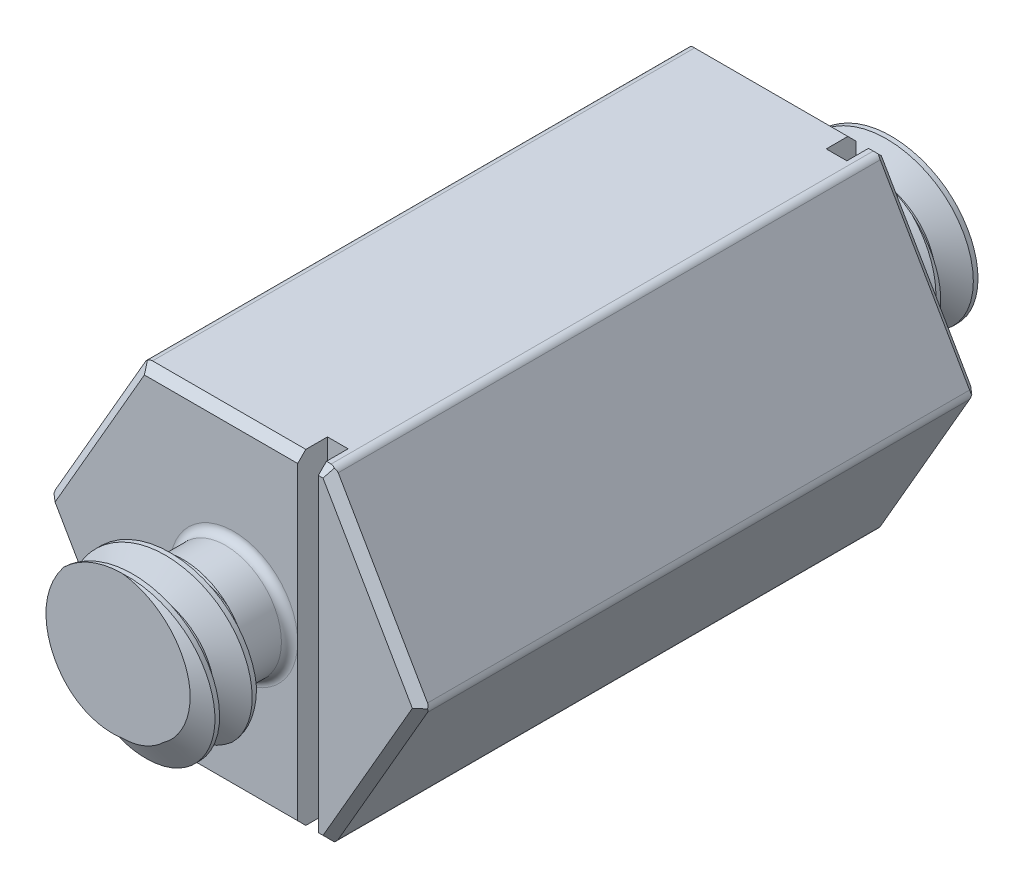
from build123d import *

# Parameters (mm, degrees)
BOSS_EXTRUDE1_DEPTH      = 4.7625
BOSS_EXTRUDE1_DEPTH_BACK = 4.7625
CHAMFER1_SIZE            = 0.13890625
FILLET1_R                = 0.13890625
CUT_SWEEP1_PITCH         = 0.635
CIRPATTERN1_COUNT        = 2
SKETCH7_R                = 2.276685385
CUT_EXTRUDE1_DEPTH       = 4.445
CUT_EXTRUDE2_START       = -22.225
SKETCH7_2_R              = 2.276685385
CUT_EXTRUDE2_DEPTH       = 4.445
SKETCH8_W                = 0.352149845
SKETCH8_H                = 2.63921875
SKETCH8_H_2              = 0.13890625
CUT_EXTRUDE3_DEPTH       = 0.508
CUT_EXTRUDE4_START       = -9.525
SKETCH8_3_W              = 0.352149845
SKETCH8_3_H              = 0.13890625
SKETCH8_3_H_2            = 2.63921875
CUT_EXTRUDE4_DEPTH       = 0.508


with BuildPart() as part:
    # Sketch3 → Revolve1 (revolve)
    with BuildSketch(Plane(origin=(0, 0, 0), x_dir=(0, 0, -1), z_dir=(1, 0, 0)), mode=Mode.PRIVATE) as revolve1_sk:
        Polygon((11.1125, 0), (-11.1125, 0), (-11.1125, 1.21285), (-10.90295, 1.4224), (-5.795796891, 1.4224), (-5.5245, 0.9525), (-4.7625, 0.9525), (-4.7625, 2.778125), (4.7625, 2.778125), (4.7625, 0.9525), (5.5245, 0.9525), (5.795796891, 1.4224), (10.90295, 1.4224), (11.1125, 1.21285), align=None)
    revolve(revolve1_sk.sketch.rotate(Axis((0, 0, 11.1125), (0, 0, -1)), 90), axis=Axis((0, 0, 11.1125), (0, 0, -1)))

    # Sketch4 → Boss-Extrude1 (add, two sides: drawn at the far end of the back side and taken through both)
    with BuildSketch(Plane.XY.offset(-BOSS_EXTRUDE1_DEPTH_BACK)):
        Polygon((-3.207902433, 0), (-1.603951217, -2.778125), (1.603951217, -2.778125), (3.207902433, 0), (1.603951217, 2.778125), (-1.603951217, 2.778125), align=None)
    extrude(amount=BOSS_EXTRUDE1_DEPTH + BOSS_EXTRUDE1_DEPTH_BACK)

    # Chamfer1
    chamfer1_edges = [part.edges().sort_by_distance(p)[0] for p in [
        (2.405926825, 1.3890625, 4.7625),
        (0, 2.778125, 4.7625),
        (-2.405926825, 1.3890625, 4.7625),
        (-2.405926825, -1.3890625, 4.7625),
        (0, -2.778125, 4.7625),
        (2.405926825, -1.3890625, 4.7625),
        (-2.405926825, 1.3890625, -4.7625),
        (0, 2.778125, -4.7625),
        (2.405926825, 1.3890625, -4.7625),
        (2.405926825, -1.3890625, -4.7625),
        (0, -2.778125, -4.7625),
        (-2.405926825, -1.3890625, -4.7625),
    ]]
    chamfer(chamfer1_edges, length=CHAMFER1_SIZE)

    # Fillet1
    fillet1_edges = [part.edges().sort_by_distance(p)[0] for p in [
        (-0.9525, 0, -4.7625),
        (-0.9525, 0, 4.7625),
        (-3.207902433, 0, 0),
        (-1.603951217, 2.778125, 0),
        (-1.603951217, -2.778125, 0),
        (1.603951217, -2.778125, 0),
        (3.207902433, 0, 0),
        (1.603951217, 2.778125, 0),
    ]]
    fillet(fillet1_edges, radius=FILLET1_R)

    # Cut-Sweep1: the profile of Sketch6 screwed along a right-hand helix of 9.604 turns, 6 arcs to a turn; built about Z, then put on its axis
    cut_sweep1_z = Axis((0, 0, 0), (0, 0, 1))
    cut_sweep1_corners = [(1.009955401, 0, -0.3175), (1.009955401, 0, -0.238125), (1.456770383, 0, 0.01984375), (1.456770383, 0, -0.57546875)]
    with BuildLine(mode=Mode.PRIVATE) as cut_sweep1_profile:
        Line(cut_sweep1_corners[0], cut_sweep1_corners[1])
        Line(cut_sweep1_corners[1], cut_sweep1_corners[2])
        Line(cut_sweep1_corners[2], cut_sweep1_corners[3])
        Line(cut_sweep1_corners[3], cut_sweep1_corners[0])
    cut_sweep1_cap = Face(cut_sweep1_profile.wire())
    cut_sweep1_turn_angles = [0, 30, 60, 90, 120, 150, 180, 210, 240, 270, 300, 330, 360]
    cut_sweep1_turn_weights = [1, 0.8660254037844387, 1, 0.8660254037844387, 1, 0.8660254037844387, 1, 0.8660254037844387, 1, 0.8660254037844387, 1, 0.8660254037844387, 1]
    cut_sweep1_turn_rails = [Edge.make_bspline([Vector(p[0], p[1], 0).rotate(cut_sweep1_z, cut_sweep1_turn_angles[k]) / cut_sweep1_turn_weights[k] + Vector(0, 0, p[2] + CUT_SWEEP1_PITCH * cut_sweep1_turn_angles[k] / 360) for k in range(13)], [0, 0, 0, 1, 1, 2, 2, 3, 3, 4, 4, 5, 5, 6, 6, 6], 2, cut_sweep1_turn_weights) for p in cut_sweep1_corners]
    cut_sweep1_turn_sides = [Face.make_surface_from_curves(cut_sweep1_turn_rails[p[0]], cut_sweep1_turn_rails[p[1]]) for p in [(0, 1), (1, 2), (2, 3), (3, 0)]]
    cut_sweep1_last_angles = [3240, 3270, 3300, 3330, 3360, 3390, 3420, 3438.72, 3457.44]
    cut_sweep1_last_weights = [1, 0.8660254037844387, 1, 0.8660254037844387, 1, 0.8660254037844387, 1, 0.9470983049947213, 1]
    cut_sweep1_last_rails = [Edge.make_bspline([Vector(p[0], p[1], 0).rotate(cut_sweep1_z, cut_sweep1_last_angles[k]) / cut_sweep1_last_weights[k] + Vector(0, 0, p[2] + CUT_SWEEP1_PITCH * cut_sweep1_last_angles[k] / 360) for k in range(9)], [0, 0, 0, 1, 1, 2, 2, 3, 3, 4, 4, 4], 2, cut_sweep1_last_weights) for p in cut_sweep1_corners]
    cut_sweep1_last_sides = [Face.make_surface_from_curves(cut_sweep1_last_rails[p[0]], cut_sweep1_last_rails[p[1]]) for p in [(0, 1), (1, 2), (2, 3), (3, 0)]]
    cut_sweep1 = Plane(origin=(0, 0, 11.1125), x_dir=(0, 1, 0), z_dir=(0, 0, -1)) * Solid(Shell([*[p.moved(Location((0, 0, CUT_SWEEP1_PITCH * i))) for i in range(9) for p in cut_sweep1_turn_sides], *cut_sweep1_last_sides, cut_sweep1_cap, cut_sweep1_cap.rotate(cut_sweep1_z, 3457.44).moved(Location((0, 0, CUT_SWEEP1_PITCH * 3457.44 / 360)))]))
    add(cut_sweep1, mode=Mode.SUBTRACT)

    # CirPattern1: Cut-Sweep1 ×2 about axis
    cirpattern1_axis = Axis((0, 0, 0), (1, 0, 0))
    for i in range(1, CIRPATTERN1_COUNT):
        add(cut_sweep1.rotate(cirpattern1_axis, i * 360 / CIRPATTERN1_COUNT), mode=Mode.SUBTRACT)

    # Sketch7 → Cut-Extrude1 (cut)
    with BuildSketch(Plane.XY.offset(11.1125)):
        Circle(SKETCH7_R)
    extrude(amount=-CUT_EXTRUDE1_DEPTH, mode=Mode.SUBTRACT)

    # Sketch7<2> → Cut-Extrude2 (cut)
    with BuildSketch(Plane.XY.offset(11.1125).offset(CUT_EXTRUDE2_START)):
        Circle(SKETCH7_2_R)
    extrude(amount=CUT_EXTRUDE2_DEPTH, mode=Mode.SUBTRACT)

    # Sketch8 → Cut-Extrude3 (cut)
    with BuildSketch(Plane(origin=(0, 0, -4.7625), x_dir=(-1, 0, 0), z_dir=(0, 0, -1))):
        with Locations((-1.267481173, 1.319609375)):
            Rectangle(SKETCH8_W, SKETCH8_H)
        with Locations((-1.267481173, -1.319609375)):
            Rectangle(SKETCH8_W, SKETCH8_H)
        with Locations((-1.267481173, -2.708671875)):
            Rectangle(SKETCH8_W, SKETCH8_H_2)
        with Locations((-1.267481173, 2.708671875)):
            Rectangle(SKETCH8_W, SKETCH8_H_2)
    extrude(amount=-CUT_EXTRUDE3_DEPTH, mode=Mode.SUBTRACT)

    # Sketch8<3> → Cut-Extrude4 (cut)
    with BuildSketch(Plane(origin=(0, 0, -4.7625), x_dir=(-1, 0, 0), z_dir=(0, 0, -1)).offset(CUT_EXTRUDE4_START)):
        with Locations((-1.267481173, 2.708671875)):
            Rectangle(SKETCH8_3_W, SKETCH8_3_H)
        with Locations((-1.267481173, 1.319609375)):
            Rectangle(SKETCH8_3_W, SKETCH8_3_H_2)
        with Locations((-1.267481173, -1.319609375)):
            Rectangle(SKETCH8_3_W, SKETCH8_3_H_2)
        with Locations((-1.267481173, -2.708671875)):
            Rectangle(SKETCH8_3_W, SKETCH8_3_H)
    extrude(amount=CUT_EXTRUDE4_DEPTH, mode=Mode.SUBTRACT)


solid = part.part
